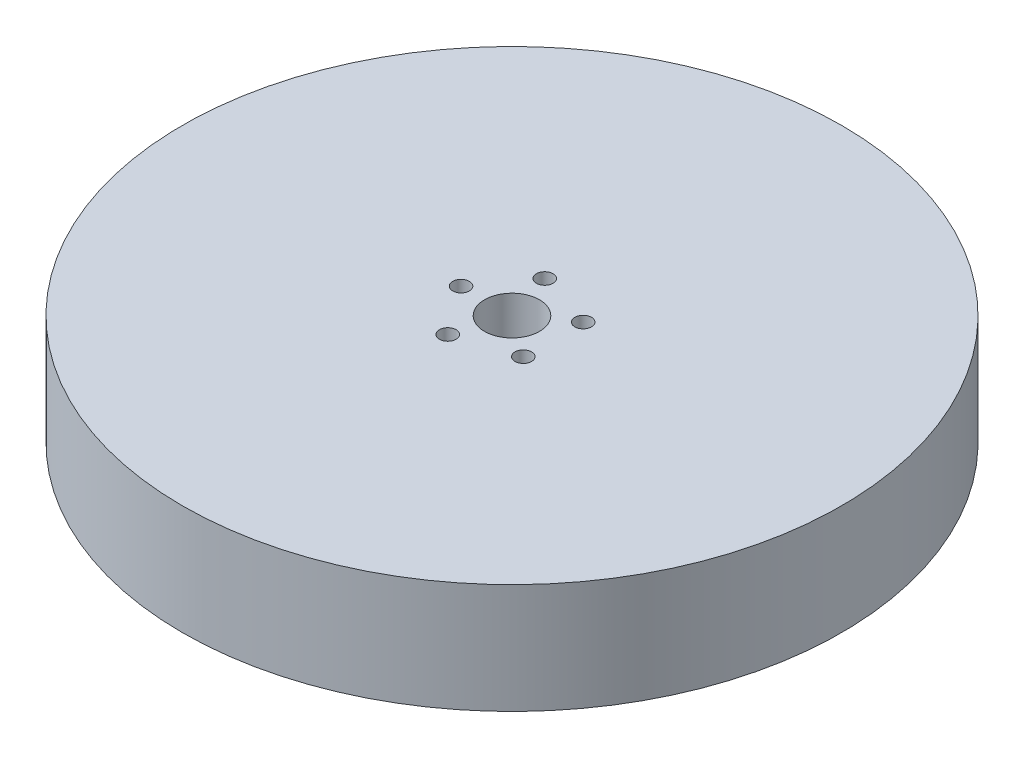
from build123d import *

# Parameters (mm, degrees)
SKETCH1_R           = 90
BOSS_EXTRUDE1_DEPTH = 30
SKETCH2_R           = 7.5
CUT_EXTRUDE1_DEPTH  = 131.766968306
SKETCH3_R           = 2.277172364
CUT_EXTRUDE2_DEPTH  = 23.095785854
CIRPATTERN1_COUNT   = 5


with BuildPart() as part:
    # Sketch1 → Boss-Extrude1 (new body)
    with BuildSketch(Plane(origin=(0, 0, 0), x_dir=(1, 0, 0), z_dir=(0, 1, 0))):
        Circle(SKETCH1_R)
    extrude(amount=BOSS_EXTRUDE1_DEPTH)

    # Sketch2 → Cut-Extrude1 (cut, through all)
    with BuildSketch(Plane(origin=(0, 0, 0), x_dir=(1, 0, 0), z_dir=(0, 1, 0))):
        Circle(SKETCH2_R)
    extrude(amount=CUT_EXTRUDE1_DEPTH, mode=Mode.SUBTRACT)

    # Sketch3 → Cut-Extrude2 (cut)
    with BuildSketch(Plane(origin=(0, 30, 0), x_dir=(1, 0, 0), z_dir=(0, 1, 0))):
        with Locations((-13.917297309, 0)):
            Circle(SKETCH3_R)
    cut_extrude2 = extrude(amount=-CUT_EXTRUDE2_DEPTH, mode=Mode.SUBTRACT)

    # CirPattern1: Cut-Extrude2 ×5 about axis
    cirpattern1_axis = Axis((0, 0, 0), (0, 1, 0))
    for i in range(1, CIRPATTERN1_COUNT):
        add(cut_extrude2.rotate(cirpattern1_axis, i * 360 / CIRPATTERN1_COUNT), mode=Mode.SUBTRACT)


solid = part.part
